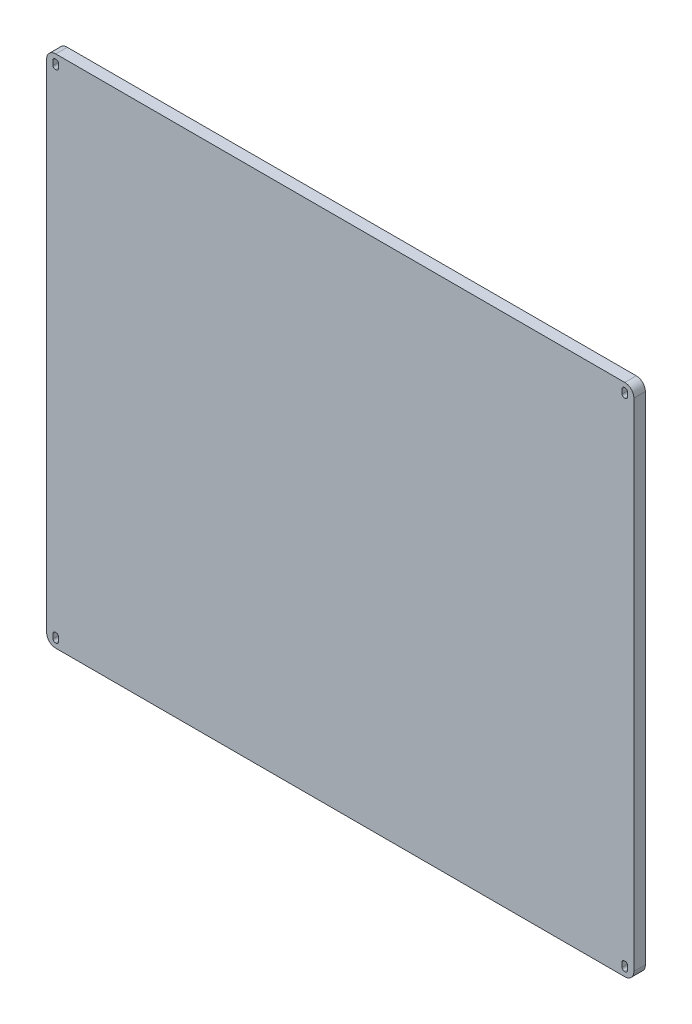
from build123d import *

# Parameters (mm, degrees)
SKETCH1_W           = 647.7
SKETCH1_H           = 567.69
BOSS_EXTRUDE1_DEPTH = 12.7
FILLET1_R           = 10


with BuildPart() as part:
    # Sketch1 → Boss-Extrude1 (new body)
    with BuildSketch(Plane.XY):
        with Locations((-14.097734139, -156.072190332)):
            Rectangle(SKETCH1_W, SKETCH1_H)
        with BuildLine():
            Line((300.252265861, -434.917190332), (299.252265861, -434.917190332))
            ThreePointArc((299.252265861, -434.917190332), (297.484498908, -434.184957285), (296.752265861, -432.417190332))
            Line((296.752265861, -432.417190332), (296.752265861, -427.417190332))
            ThreePointArc((296.752265861, -427.417190332), (297.484498908, -425.649423379), (299.252265861, -424.917190332))
            Line((299.252265861, -424.917190332), (300.252265861, -424.917190332))
            ThreePointArc((300.252265861, -424.917190332), (302.020032814, -425.649423379), (302.752265861, -427.417190332))
            Line((302.752265861, -427.417190332), (302.752265861, -432.417190332))
            ThreePointArc((302.752265861, -432.417190332), (302.020032814, -434.184957285), (300.252265861, -434.917190332))
        make_face(mode=Mode.SUBTRACT)
        with BuildLine():
            Line((-327.447734139, -434.917190332), (-328.447734139, -434.917190332))
            ThreePointArc((-328.447734139, -434.917190332), (-330.215501092, -434.184957285), (-330.947734139, -432.417190332))
            Line((-330.947734139, -432.417190332), (-330.947734139, -427.417190332))
            ThreePointArc((-330.947734139, -427.417190332), (-330.215501092, -425.649423379), (-328.447734139, -424.917190332))
            Line((-328.447734139, -424.917190332), (-327.447734139, -424.917190332))
            ThreePointArc((-327.447734139, -424.917190332), (-325.679967186, -425.649423379), (-324.947734139, -427.417190332))
            Line((-324.947734139, -427.417190332), (-324.947734139, -432.417190332))
            ThreePointArc((-324.947734139, -432.417190332), (-325.679967186, -434.184957285), (-327.447734139, -434.917190332))
        make_face(mode=Mode.SUBTRACT)
        with BuildLine():
            Line((-327.447734139, 112.772809668), (-328.447734139, 112.772809668))
            ThreePointArc((-328.447734139, 112.772809668), (-330.215501092, 113.505042715), (-330.947734139, 115.272809668))
            Line((-330.947734139, 115.272809668), (-330.947734139, 120.272809668))
            ThreePointArc((-330.947734139, 120.272809668), (-330.215501092, 122.040576621), (-328.447734139, 122.772809668))
            Line((-328.447734139, 122.772809668), (-327.447734139, 122.772809668))
            ThreePointArc((-327.447734139, 122.772809668), (-325.679967186, 122.040576621), (-324.947734139, 120.272809668))
            Line((-324.947734139, 120.272809668), (-324.947734139, 115.272809668))
            ThreePointArc((-324.947734139, 115.272809668), (-325.679967186, 113.505042715), (-327.447734139, 112.772809668))
        make_face(mode=Mode.SUBTRACT)
        with BuildLine():
            Line((300.252265861, 112.772809668), (299.252265861, 112.772809668))
            ThreePointArc((299.252265861, 112.772809668), (297.484498908, 113.505042715), (296.752265861, 115.272809668))
            Line((296.752265861, 115.272809668), (296.752265861, 120.272809668))
            ThreePointArc((296.752265861, 120.272809668), (297.484498908, 122.040576621), (299.252265861, 122.772809668))
            Line((299.252265861, 122.772809668), (300.252265861, 122.772809668))
            ThreePointArc((300.252265861, 122.772809668), (302.020032814, 122.040576621), (302.752265861, 120.272809668))
            Line((302.752265861, 120.272809668), (302.752265861, 115.272809668))
            ThreePointArc((302.752265861, 115.272809668), (302.020032814, 113.505042715), (300.252265861, 112.772809668))
        make_face(mode=Mode.SUBTRACT)
    extrude(amount=BOSS_EXTRUDE1_DEPTH)

    # Fillet1
    fillet1_edges = [part.edges().sort_by_distance(p)[0] for p in [
        (-337.947734139, -439.917190332, 6.35),
        (309.752265861, -439.917190332, 6.35),
        (-337.947734139, 127.772809668, 6.35),
        (309.752265861, 127.772809668, 6.35),
    ]]
    fillet(fillet1_edges, radius=FILLET1_R)


solid = part.part
